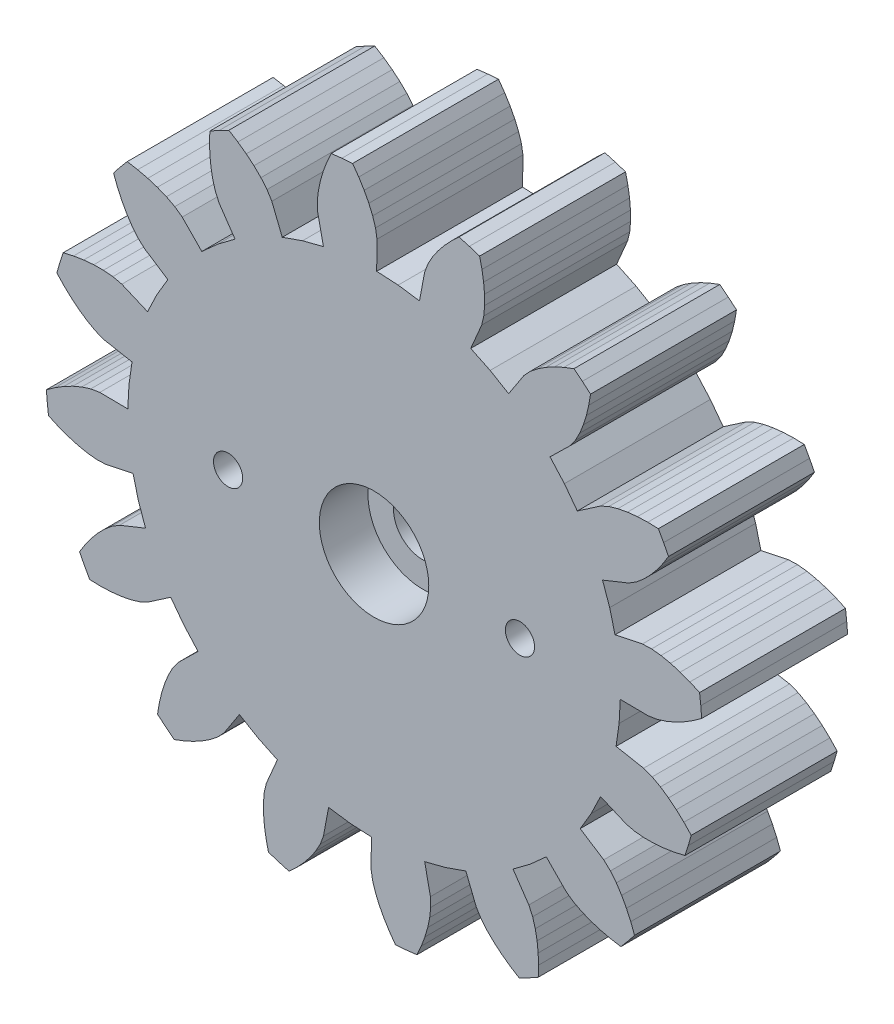
from build123d import *

# Parameters (mm, degrees)
BOSS_EXTRUDE1_START     = 14
BOSS_EXTRUDE1_DEPTH     = 6
CUT_EXTRUDE1_DEPTH      = 28.621462489
CUT_EXTRUDE1_DEPTH_BACK = 28.621462489
SKETCH2_R               = 1.2
CUT_EXTRUDE2_START      = 18
SKETCH3_R               = 2.25
CUT_EXTRUDE2_DEPTH      = 2
CUT_EXTRUDE3_START      = 14
SKETCH4_R               = 3.8
CUT_EXTRUDE3_DEPTH      = 2.5
CUT_EXTRUDE4_DEPTH      = 28.621462489
CUT_EXTRUDE4_DEPTH_BACK = 28.621462489
SKETCH5_R               = 0.6


with BuildPart() as part:
    # Sketch1 → Boss-Extrude1 (new body)
    with BuildSketch(Plane.XY.offset(BOSS_EXTRUDE1_START)):
        Polygon((0.108717297, 10.124416307), (0.121079517, 11.275661384), (0.060578846, 11.646768663), (-0.056501696, 12.017408141), (-0.213545386, 12.386315054), (-0.405181151, 12.752335177), (-0.628518832, 13.114332652), (-0.881705726, 13.471176452), (-1.323231394, 13.43499381), (-1.763332154, 13.384343828), (-1.942037362, 12.984962368), (-2.090461467, 12.586349554), (-2.207008021, 12.189976122), (-2.289063992, 11.797519948), (-2.33158669, 11.411160923), (-2.318525418, 11.035381271), (-2.081803963, 9.908668794), (-2.939132357, 9.689020899), (-3.774004697, 9.395345313), (-4.203145914, 10.463687894), (-4.401057852, 10.783393709), (-4.651063756, 11.081015153), (-4.937327771, 11.361742681), (-5.254445969, 11.626565348), (-5.599313517, 11.875539776), (-5.969785917, 12.10833003), (-6.363855947, 11.905937069), (-6.751073123, 11.690723318), (-6.763338538, 11.253355439), (-6.747922011, 10.828285772), (-6.703911442, 10.417484036), (-6.629534798, 10.023500349), (-6.52096745, 9.650278421), (-6.365095762, 9.308101624), (-5.715219456, 8.357744407), (-6.423232002, 7.82673084), (-7.082168688, 7.235918164), (-7.88748048, 8.058712775), (-8.192673388, 8.278344814), (-8.537543522, 8.457638056), (-8.90944676, 8.607447978), (-9.303769019, 8.73075634), (-9.717663477, 8.828803621), (-10.149020318, 8.902100122), (-10.43564112, 8.564309336), (-10.711024407, 8.217296159), (-10.554982732, 7.808527156), (-10.378072599, 7.421713641), (-10.180205116, 7.05902444), (-9.960719028, 6.723493685), (-9.717590029, 6.42022851), (-9.442637975, 6.163747884), (-8.478544596, 5.534429197), (-8.929452802, 4.77289196), (-9.312136696, 3.974888069), (-10.371017644, 4.426871688), (-10.737028667, 4.512992964), (-11.124259679, 4.546662235), (-11.525183243, 4.542747348), (-11.936677576, 4.505768824), (-12.356587263, 4.437962148), (-12.783158377, 4.340606169), (-12.918694532, 3.918843143), (-13.04031932, 3.49286015), (-12.739726486, 3.174921399), (-12.428255712, 2.885252885), (-12.106654846, 2.625892364), (-11.775474079, 2.399896056), (-11.434797616, 2.212757008), (-11.082624155, 2.081019403), (-9.951088179, 1.868547312), (-10.076245358, 0.992423546), (-10.124416307, 0.108717297), (-11.275661384, 0.121079517), (-11.646768663, 0.060578846), (-12.017408141, -0.056501696), (-12.386315054, -0.213545386), (-12.752335177, -0.405181151), (-13.114332652, -0.628518832), (-13.471176452, -0.881705726), (-13.43499381, -1.323231394), (-13.384343828, -1.763332154), (-12.984962368, -1.942037362), (-12.586349554, -2.090461467), (-12.189976122, -2.207008021), (-11.797519948, -2.289063992), (-11.411160923, -2.33158669), (-11.035381271, -2.318525418), (-9.908668794, -2.081803963), (-9.689020899, -2.939132357), (-9.395345313, -3.774004697), (-10.463687894, -4.203145914), (-10.783393709, -4.401057852), (-11.081015153, -4.651063756), (-11.361742681, -4.937327771), (-11.626565348, -5.254445969), (-11.875539776, -5.599313517), (-12.10833003, -5.969785917), (-11.905937069, -6.363855947), (-11.690723318, -6.751073123), (-11.253355439, -6.763338538), (-10.828285772, -6.747922011), (-10.417484036, -6.703911442), (-10.023500349, -6.629534798), (-9.650278421, -6.52096745), (-9.308101624, -6.365095762), (-8.357744407, -5.715219456), (-7.82673084, -6.423232002), (-7.235918164, -7.082168688), (-8.058712775, -7.88748048), (-8.278344814, -8.192673388), (-8.457638056, -8.537543522), (-8.607447978, -8.90944676), (-8.73075634, -9.303769019), (-8.828803621, -9.717663477), (-8.902100122, -10.149020318), (-8.564309336, -10.43564112), (-8.217296159, -10.711024407), (-7.808527156, -10.554982732), (-7.421713641, -10.378072599), (-7.05902444, -10.180205116), (-6.723493685, -9.960719028), (-6.42022851, -9.717590029), (-6.163747884, -9.442637975), (-5.534429197, -8.478544596), (-4.77289196, -8.929452802), (-3.974888069, -9.312136696), (-4.426871688, -10.371017644), (-4.512992964, -10.737028667), (-4.546662235, -11.124259679), (-4.542747348, -11.525183243), (-4.505768824, -11.936677576), (-4.437962148, -12.356587263), (-4.340606169, -12.783158377), (-3.918843143, -12.918694532), (-3.49286015, -13.04031932), (-3.174921399, -12.739726486), (-2.885252885, -12.428255712), (-2.625892364, -12.106654846), (-2.399896056, -11.775474079), (-2.212757008, -11.434797616), (-2.081019403, -11.082624155), (-1.868547312, -9.951088179), (-0.992423546, -10.076245358), (-0.108717297, -10.124416307), (-0.121079517, -11.275661384), (-0.060578846, -11.646768663), (0.056501696, -12.017408141), (0.213545386, -12.386315054), (0.405181151, -12.752335177), (0.628518832, -13.114332652), (0.881705726, -13.471176452), (1.323231394, -13.43499381), (1.763332154, -13.384343828), (1.942037362, -12.984962368), (2.090461467, -12.586349554), (2.207008021, -12.189976122), (2.289063992, -11.797519948), (2.33158669, -11.411160923), (2.318525418, -11.035381271), (2.081803963, -9.908668794), (2.939132357, -9.689020899), (3.774004697, -9.395345313), (4.203145914, -10.463687894), (4.401057852, -10.783393709), (4.651063756, -11.081015153), (4.937327771, -11.361742681), (5.254445969, -11.626565348), (5.599313517, -11.875539776), (5.969785917, -12.10833003), (6.363855947, -11.905937069), (6.751073123, -11.690723318), (6.763338538, -11.253355439), (6.747922011, -10.828285772), (6.703911442, -10.417484036), (6.629534798, -10.023500349), (6.52096745, -9.650278421), (6.365095762, -9.308101624), (5.715219456, -8.357744407), (6.423232002, -7.82673084), (7.082168688, -7.235918164), (7.88748048, -8.058712775), (8.192673388, -8.278344814), (8.537543522, -8.457638056), (8.90944676, -8.607447978), (9.303769019, -8.73075634), (9.717663477, -8.828803621), (10.149020318, -8.902100122), (10.43564112, -8.564309336), (10.711024407, -8.217296159), (10.554982732, -7.808527156), (10.378072599, -7.421713641), (10.180205116, -7.05902444), (9.960719028, -6.723493685), (9.717590029, -6.42022851), (9.442637975, -6.163747884), (8.478544596, -5.534429197), (8.929452802, -4.77289196), (9.312136696, -3.974888069), (10.371017644, -4.426871688), (10.737028667, -4.512992964), (11.124259679, -4.546662235), (11.525183243, -4.542747348), (11.936677576, -4.505768824), (12.356587263, -4.437962148), (12.783158377, -4.340606169), (12.918694532, -3.918843143), (13.04031932, -3.49286015), (12.739726486, -3.174921399), (12.428255712, -2.885252885), (12.106654846, -2.625892364), (11.775474079, -2.399896056), (11.434797616, -2.212757008), (11.082624155, -2.081019403), (9.951088179, -1.868547312), (10.076245358, -0.992423546), (10.124416307, -0.108717297), (11.275661384, -0.121079517), (11.646768663, -0.060578846), (12.017408141, 0.056501696), (12.386315054, 0.213545386), (12.752335177, 0.405181151), (13.114332652, 0.628518832), (13.471176452, 0.881705726), (13.43499381, 1.323231394), (13.384343828, 1.763332154), (12.984962368, 1.942037362), (12.586349554, 2.090461467), (12.189976122, 2.207008021), (11.797519948, 2.289063992), (11.411160923, 2.33158669), (11.035381271, 2.318525418), (9.908668794, 2.081803963), (9.689020899, 2.939132357), (9.395345313, 3.774004697), (10.463687894, 4.203145914), (10.783393709, 4.401057852), (11.081015153, 4.651063756), (11.361742681, 4.937327771), (11.626565348, 5.254445969), (11.875539776, 5.599313517), (12.10833003, 5.969785917), (11.905937069, 6.363855947), (11.690723318, 6.751073123), (11.253355439, 6.763338538), (10.828285772, 6.747922011), (10.417484036, 6.703911442), (10.023500349, 6.629534798), (9.650278421, 6.52096745), (9.308101624, 6.365095762), (8.357744407, 5.715219456), (7.82673084, 6.423232002), (7.235918164, 7.082168688), (8.058712775, 7.88748048), (8.278344814, 8.192673388), (8.457638056, 8.537543522), (8.607447978, 8.90944676), (8.73075634, 9.303769019), (8.828803621, 9.717663477), (8.902100122, 10.149020318), (8.564309336, 10.43564112), (8.217296159, 10.711024407), (7.808527156, 10.554982732), (7.421713641, 10.378072599), (7.05902444, 10.180205116), (6.723493685, 9.960719028), (6.42022851, 9.717590029), (6.163747884, 9.442637975), (5.534429197, 8.478544596), (4.77289196, 8.929452802), (3.974888069, 9.312136696), (4.426871688, 10.371017644), (4.512992964, 10.737028667), (4.546662235, 11.124259679), (4.542747348, 11.525183243), (4.505768824, 11.936677576), (4.437962148, 12.356587263), (4.340606169, 12.783158377), (3.918843143, 12.918694532), (3.49286015, 13.04031932), (3.174921399, 12.739726486), (2.885252885, 12.428255712), (2.625892364, 12.106654846), (2.399896056, 11.775474079), (2.212757008, 11.434797616), (2.081019403, 11.082624155), (1.868547312, 9.951088179), (0.992423546, 10.076245358), align=None)
    extrude(amount=BOSS_EXTRUDE1_DEPTH)

    # Sketch2 → Cut-Extrude1 (cut, two sides: drawn at the far end of the back side and taken through both)
    with BuildSketch(Plane.XY.offset(-CUT_EXTRUDE1_DEPTH_BACK)):
        Circle(SKETCH2_R)
    extrude(amount=CUT_EXTRUDE1_DEPTH + CUT_EXTRUDE1_DEPTH_BACK, mode=Mode.SUBTRACT)

    # Sketch3 → Cut-Extrude2 (cut)
    with BuildSketch(Plane.XY.offset(CUT_EXTRUDE2_START)):
        Circle(SKETCH3_R)
    extrude(amount=CUT_EXTRUDE2_DEPTH, mode=Mode.SUBTRACT)

    # Sketch4 → Cut-Extrude3 (cut)
    with BuildSketch(Plane.XY.offset(CUT_EXTRUDE3_START)):
        Circle(SKETCH4_R)
    extrude(amount=CUT_EXTRUDE3_DEPTH, mode=Mode.SUBTRACT)

    # Sketch5 → Cut-Extrude4 (cut, two sides: drawn at the far end of the back side and taken through both)
    with BuildSketch(Plane.XY.offset(-CUT_EXTRUDE4_DEPTH_BACK)):
        with Locations((6, 0)):
            Circle(SKETCH5_R)
        with Locations((-6, 0)):
            Circle(SKETCH5_R)
    extrude(amount=CUT_EXTRUDE4_DEPTH + CUT_EXTRUDE4_DEPTH_BACK, mode=Mode.SUBTRACT)


solid = part.part
